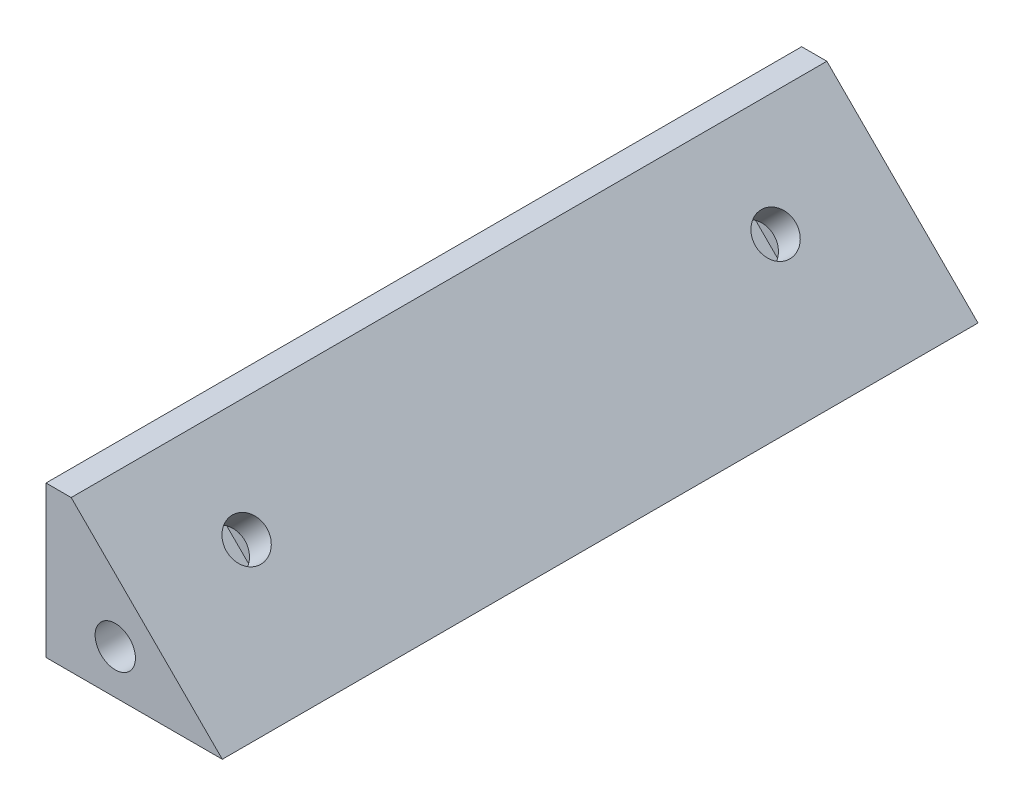
from build123d import *

# Parameters (mm, degrees)
BOSS_EXTRUDE1_DEPTH     = 30
SKETCH1_13_W            = 2
SKETCH1_13_H            = 12
BOSS_EXTRUDE6_DEPTH     = 30
CUT_EXTRUDE3_DEPTH      = 5
BOSS_EXTRUDE4_START     = -2.45
BOSS_EXTRUDE4_OUTLINE_W = 30
BOSS_EXTRUDE4_OUTLINE_H = 14.485281374
BOSS_EXTRUDE4_OUTLINE_R = 1.6
BOSS_EXTRUDE4_DEPTH     = 2.45
CUT_EXTRUDE1_DEPTH      = 5
SKETCH1_10_R            = 1.6
BOSS_EXTRUDE5_DEPTH     = 2.45
CUT_EXTRUDE4_DEPTH      = 63.353829072


# Read off the part's stored shape, not the designer's step: Boss-Extrude4
with BuildPart() as part:
    # Sketch1 → Boss-Extrude1 (new body)
    with BuildSketch(Plane.XY):
        Polygon((0, 12), (12, 0), (0, 0), align=None)
    boss_extrude1 = extrude(amount=BOSS_EXTRUDE1_DEPTH)

    # Sketch1<13> → Boss-Extrude6 (add)
    with BuildSketch(Plane.XY):
        with Locations((-1, 6)):
            Rectangle(SKETCH1_13_W, SKETCH1_13_H)
    boss_extrude6 = extrude(amount=BOSS_EXTRUDE6_DEPTH)

    # Sketch4 → Cut-Extrude3 (cut)
    with BuildSketch(Plane(origin=(6, 6, 0), x_dir=(0, 0, -1), z_dir=(0.7071067811865477, 0.7071067811865475, 0))):
        Polygon((-6.175, -8.485281374), (-6.175, 3.145733136), (-9, 4.776747647), (-11.825, 3.145733136), (-11.825, -8.485281374), align=None)
    cut_extrude3 = extrude(amount=-CUT_EXTRUDE3_DEPTH, mode=Mode.SUBTRACT)

    # Boss-Extrude4 outline → Boss-Extrude4 (add)
    with BuildSketch(Plane(origin=(6, 6, 0), x_dir=(0, 0, -1), z_dir=(0.7071067811865477, 0.7071067811865475, 0)).offset(BOSS_EXTRUDE4_START)):
        with Locations((-15, -1.242640687)):
            Rectangle(BOSS_EXTRUDE4_OUTLINE_W, BOSS_EXTRUDE4_OUTLINE_H)
        with Locations((-9, 1.514718626)):
            Circle(BOSS_EXTRUDE4_OUTLINE_R, mode=Mode.SUBTRACT)
    boss_extrude4 = extrude(amount=BOSS_EXTRUDE4_DEPTH)

    # Sketch1<4> → Cut-Extrude1 (cut)
    with BuildSketch(Plane.XY):
        Polygon((10.669337222, 0), (4.440608352, 6.623473909), (1.265296423, 5.876327682), (0.324688071, 2.752853773), (2.91347758, 0), align=None)
    cut_extrude1 = extrude(amount=CUT_EXTRUDE1_DEPTH, mode=Mode.SUBTRACT)

    # Sketch1<10> → Boss-Extrude5 (add)
    # profile 1 of 2: a face of its own
    with BuildSketch(Plane.XY):
        Polygon((2.559391648, 0.376526091), (5.734703577, 1.123672318), (6.675311929, 4.247146227), (4.440608352, 6.623473909), (1.265296423, 5.876327682), (0.324688071, 2.752853773), align=None)
        with Locations((3.5, 3.5)):
            Circle(SKETCH1_10_R, mode=Mode.SUBTRACT)
    # profile 2 of 2: a face of its own
    with BuildSketch(Plane.XY):
        Polygon((3.5, 0), (10.669337222, 0), (6.675311929, 4.247146227), (5.734703577, 1.123672318), (2.559391648, 0.376526091), (2.91347758, 0), align=None)
    boss_extrude5 = extrude(amount=BOSS_EXTRUDE5_DEPTH)

    # Mirror1: Boss-Extrude1, Boss-Extrude6, Cut-Extrude3, Boss-Extrude4, Cut-Extrude1, Boss-Extrude5 across plane
    add(boss_extrude1.mirror(Plane.XY.offset(30)))
    add(boss_extrude6.mirror(Plane.XY.offset(30)))
    add(cut_extrude3.mirror(Plane.XY.offset(30)), mode=Mode.SUBTRACT)
    add(boss_extrude4.mirror(Plane.XY.offset(30)))
    add(cut_extrude1.mirror(Plane.XY.offset(30)), mode=Mode.SUBTRACT)
    add(boss_extrude5.mirror(Plane.XY.offset(30)))

    # Sketch1<12> → Cut-Extrude4 (cut, through all)
    with BuildSketch(Plane.XY):
        Polygon((12, -3.5), (12, 0), (10.669337222, 0), (3.5, 0), (2.91347758, 0), (1.441458618, 0), (0, 0), (0, -3.5), align=None)
    extrude(amount=CUT_EXTRUDE4_DEPTH, mode=Mode.SUBTRACT)


solid = part.part
